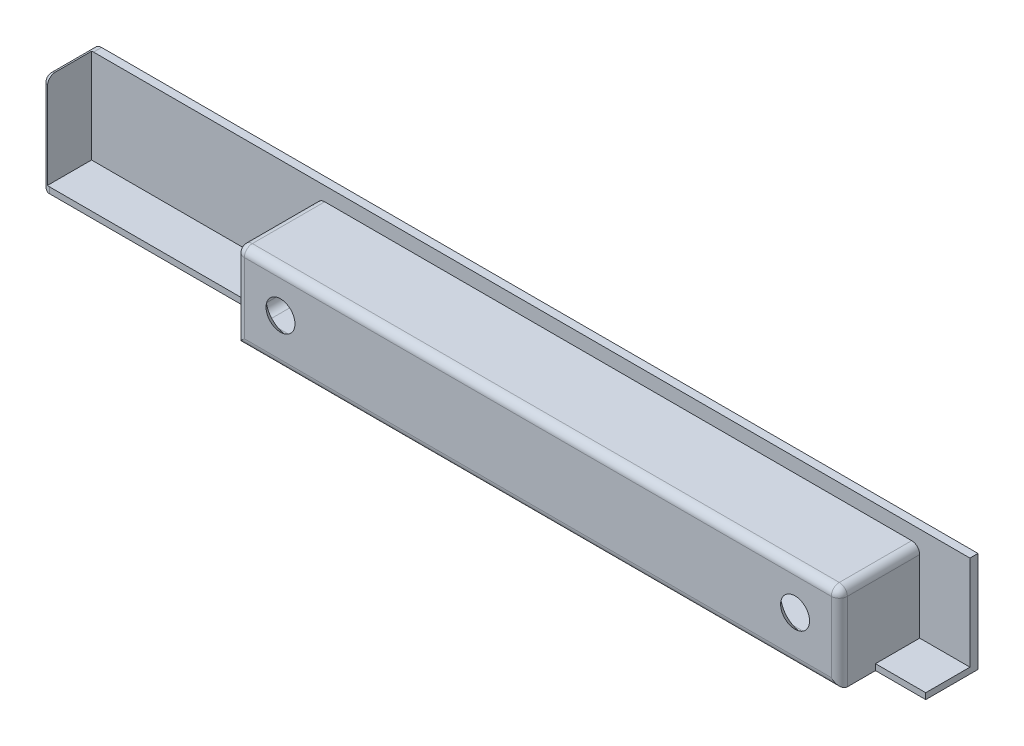
from build123d import *

# Parameters (mm, degrees)
CROQUIS1_W                                   = 220
CROQUIS1_H                                   = 25
SALIENTE_EXTRUIR1_DEPTH                      = 2
SALIENTE_EXTRUIR2_DEPTH                      = 11
SALIENTE_EXTRUIR3_DEPTH                      = 7
CROQUIS5_W                                   = 150
CROQUIS5_H                                   = 20
SALIENTE_EXTRUIR4_DEPTH                      = 2
REDONDEO2_R                                  = 2
REDONDEO3_R                                  = 2
REDONDEO4_R                                  = 2
CROQUIS7_W                                   = 147
CROQUIS7_H                                   = 20
CORTAR_EXTRUIR1_DEPTH                        = 2
CROQUIS10_W                                  = 150
CROQUIS10_H                                  = 1.5
SALIENTE_EXTRUIR8_DEPTH                      = 15
CROQUIS11_R                                  = 2.25
CORTAR_EXTRUIR2_DEPTH                        = 15
REFRENTADO_PARA_TORNILLO_TAP_N_CON_C_2_COUNT = 2
REFRENTADO_PARA_TORNILLO_TAP_N_CON_C_2_PITCH = 128
REDONDEO5_R                                  = 2
CROQUIS14_W                                  = 147
CROQUIS14_H                                  = 3
SALIENTE_EXTRUIR9_DEPTH                      = 13
REDONDEO6_R                                  = 2


with BuildPart() as part:
    # Croquis1 → Saliente-Extruir1 (new body)
    with BuildSketch(Plane.XY):
        with Locations((-129.544939143, 51.184210526)):
            Rectangle(CROQUIS1_W, CROQUIS1_H)
    extrude(amount=SALIENTE_EXTRUIR1_DEPTH)

    # Croquis3 → Saliente-Extruir2 (add)
    with BuildSketch(Plane.XY.offset(2)):
        Polygon((-239.544939143, 63.684210526), (-239.544939143, 38.684210526), (-180.544939143, 38.684210526), (-180.544939143, 58.684210526), (-33.544939143, 58.684210526), (-33.544939143, 38.684210526), (-19.544939143, 38.684210526), (-19.544939143, 40.184210526), (-32.044939143, 40.184210526), (-32.044939143, 60.184210526), (-182.044939143, 60.184210526), (-182.044939143, 40.184210526), (-238.044939143, 40.184210526), (-238.044939143, 63.684210526), align=None)
    extrude(amount=SALIENTE_EXTRUIR2_DEPTH)

    # Croquis4 → Saliente-Extruir3 (add)
    with BuildSketch(Plane.XY.offset(13)):
        Polygon((-182.044939143, 40.184210526), (-180.544939143, 40.184210526), (-180.544939143, 40.470961068), (-180.544939143, 58.684210526), (-33.544939143, 58.684210526), (-33.544939143, 40.470961068), (-33.544939143, 40.184210526), (-32.044939143, 40.184210526), (-32.044939143, 40.470961068), (-32.044939143, 60.184210526), (-182.044939143, 60.184210526), align=None)
    extrude(amount=SALIENTE_EXTRUIR3_DEPTH)

    # Croquis5 → Saliente-Extruir4 (add)
    with BuildSketch(Plane.XY.offset(20)):
        with Locations((-107.044939143, 50.184210526)):
            Rectangle(CROQUIS5_W, CROQUIS5_H)
    extrude(amount=SALIENTE_EXTRUIR4_DEPTH)

    # Redondeo2
    redondeo2_edges = [part.edges().sort_by_distance(p)[0] for p in [
        (-239.544939143, 63.684210526, 6.5),
    ]]
    fillet(redondeo2_edges, radius=REDONDEO2_R)

    # Redondeo3
    # the kernel refuses this fillet: 2 mm, written as the material it takes off along each edge
    with BuildSketch(Plane(origin=(-239.544939143, 61.684210526, 13), x_dir=(1, 0, 0), z_dir=(0, -1, 0))) as redondeo3_piece_1:
        with BuildLine():
            CenterArc((REDONDEO3_R, -REDONDEO3_R), REDONDEO3_R, 90, 90)
            Line((0, -REDONDEO3_R), (0, 0))
            Line((0, 0), (REDONDEO3_R, 0))
        make_face()
    extrude(amount=28, mode=Mode.SUBTRACT)
    with BuildSketch(Plane(origin=(-237.544939143, 61.684210526, 13), x_dir=(0.7793111641702657, -0.6266371433290445, 0), z_dir=(-0.6266371433290445, -0.7793111641702657, 0))) as redondeo3_piece_2:
        with BuildLine():
            CenterArc((2 - REDONDEO3_R, -REDONDEO3_R), REDONDEO3_R, 0, 90)
            Line((2 - REDONDEO3_R, 0), (2, 0))
            Line((2, 0), (2, -REDONDEO3_R))
        make_face()
    revolve(axis=Axis((-237.544939143, 61.684210526, 13), (0, 0, 1)), revolution_arc=218.802450559, mode=Mode.SUBTRACT)

    # Redondeo4
    # the kernel refuses this fillet: 2 mm, written as the material it takes off along each edge
    with BuildSketch(Plane(origin=(-239.544939143, 38.684210526, -5), x_dir=(0, 1, 0), z_dir=(0, 0, 1))) as redondeo4_piece_1:
        with BuildLine():
            CenterArc((REDONDEO4_R, -REDONDEO4_R), REDONDEO4_R, 90, 90)
            Line((0, -REDONDEO4_R), (0, 0))
            Line((0, 0), (REDONDEO4_R, 0))
        make_face()
    extrude(amount=21, mode=Mode.SUBTRACT)

    # Croquis7 → Cortar-Extruir1 (cut)
    with BuildSketch(Plane.XY.offset(2)):
        with Locations((-107.044939143, 48.684210526)):
            Rectangle(CROQUIS7_W, CROQUIS7_H)
    extrude(amount=-CORTAR_EXTRUIR1_DEPTH, mode=Mode.SUBTRACT)

    # Croquis10 → Saliente-Extruir8 (add)
    with BuildSketch(Plane.XY.offset(22)):
        with Locations((-107.044939143, 39.434210526)):
            Rectangle(CROQUIS10_W, CROQUIS10_H)
    extrude(amount=-SALIENTE_EXTRUIR8_DEPTH)

    # Croquis11 → Cortar-Extruir2 (cut)
    with BuildSketch(Plane.XY.offset(22)):
        with Locations((-171.044939143, 50.184210526)):
            Circle(CROQUIS11_R)
        with Locations((-43.044939143, 50.184210526)):
            Circle(CROQUIS11_R)
    extrude(amount=-CORTAR_EXTRUIR2_DEPTH, mode=Mode.SUBTRACT)

    # Croquis12 → Refrentado para tornillo tapón con cabeza plana de clavija de M51 (revolve, cut)
    with BuildSketch(Plane(origin=(-171.044939143, 50.184210526, 20), x_dir=(0, 1, 0), z_dir=(1, 0, 0))):
        Polygon((0, 0), (0, 2), (2.9, 2), (2.9, 2.7), (5.6, 0), align=None)
    refrentado_para_tornillo_tap_n_con_cabez = revolve(axis=Axis((-171.044939143, 50.184210526, 13.65), (0, 0, 1)), mode=Mode.SUBTRACT)

    # Refrentado para tornillo tap_n con c 2: Refrentado para tornillo tapón con cabeza plana de clavija de M51 ×2
    with Locations(*[(i * REFRENTADO_PARA_TORNILLO_TAP_N_CON_C_2_PITCH, 0, 0) for i in range(1, REFRENTADO_PARA_TORNILLO_TAP_N_CON_C_2_COUNT)]):
        add(refrentado_para_tornillo_tap_n_con_cabez, mode=Mode.SUBTRACT)

    # Redondeo5
    redondeo5_edges = [part.edges().sort_by_distance(p)[0] for p in [
        (-107.044939143, 38.684210526, 22),
        (-32.044939143, 60.184210526, 12),
        (-182.044939143, 60.184210526, 12),
        (-182.044939143, 49.434210526, 22),
        (-32.044939143, 49.434210526, 22),
        (-107.044939143, 60.184210526, 22),
    ]]
    fillet(redondeo5_edges, radius=REDONDEO5_R)

    # Croquis14 → Saliente-Extruir9 (add)
    with BuildSketch(Plane(origin=(0, 0, 20), x_dir=(-1, 0, 0), z_dir=(0, 0, -1))):
        with Locations((107.044939143, 41.684210526)):
            Rectangle(CROQUIS14_W, CROQUIS14_H)
    extrude(amount=SALIENTE_EXTRUIR9_DEPTH)

    # Redondeo6
    redondeo6_edges = [part.edges().sort_by_distance(p)[0] for p in [
        (-180.544939143, 43.184210526, 13.5),
        (-107.044939143, 43.184210526, 20),
        (-33.544939143, 43.184210526, 13.5),
    ]]
    fillet(redondeo6_edges, radius=REDONDEO6_R)


solid = part.part
